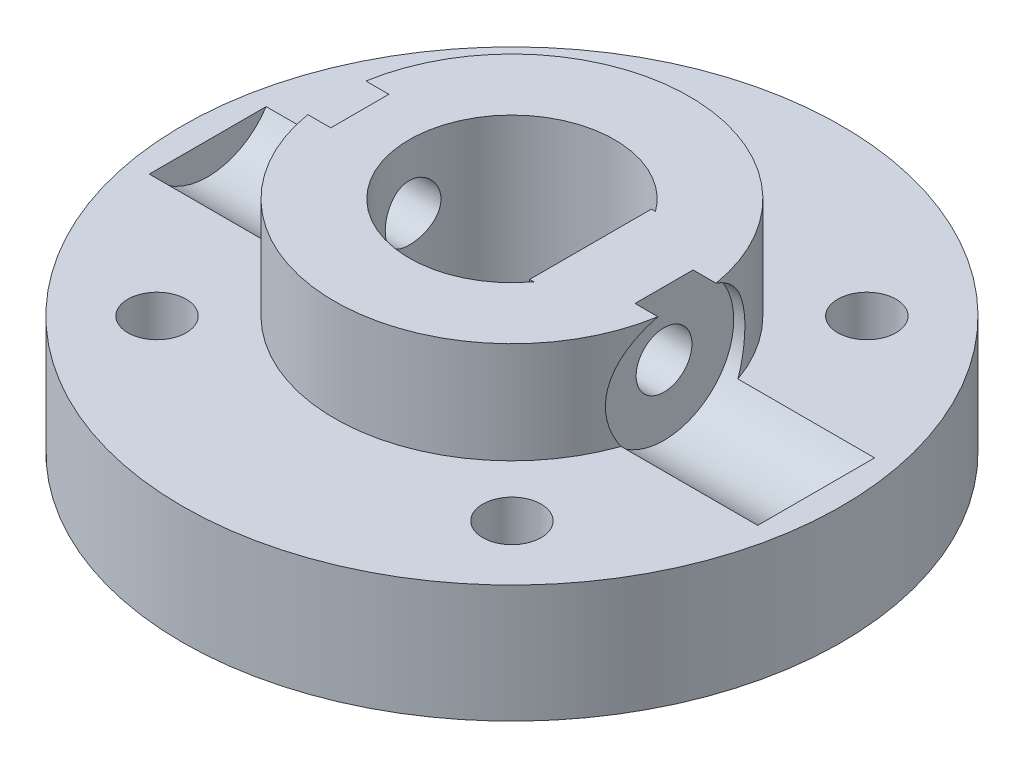
from build123d import *

# Parameters (mm, degrees)
STOCK_HORN_DRIVE_FLANGE_START              = 41
STOCK_HORN_DRIVE_FLANGE_PROFILE_R          = 13
STOCK_HORN_DRIVE_FLANGE_PROFILE_R_2        = 4.05
STOCK_HORN_DRIVE_FLANGE_DEPTH              = 3
D_COUPLING_RING_START                      = 44
D_COUPLING_RING_PROFILE_R                  = 7
D_COUPLING_RING_PROFILE_R_2                = 4.05
D_COUPLING_RING_DEPTH                      = 4
D_KEY_LAND_START                           = 44
D_KEY_LAND_PROFILE_W                       = 2.9
D_KEY_LAND_PROFILE_H                       = 4.8
D_KEY_LAND_DEPTH                           = 4
CAPTURED_HORN_KEY_BOSS_START               = 39.35
CAPTURED_HORN_KEY_BOSS_PROFILE_R           = 13
CAPTURED_HORN_KEY_BOSS_DEPTH               = 1.65
KEY_POCKET_HUB_START                       = 39.35
STOCK_HORN_POCKET_HUB_R                    = 3.55
KEY_POCKET_HUB_DEPTH                       = 1.65
KEY_POCKET_HORIZONTAL_START                = 39.35
STOCK_HORN_POCKET_HORIZONTAL_W             = 16.3
STOCK_HORN_POCKET_HORIZONTAL_H             = 4.2
KEY_POCKET_HORIZONTAL_DEPTH                = 1.65
KEY_POCKET_VERTICAL_START                  = 39.35
STOCK_HORN_POCKET_VERTICAL_W               = 4.2
STOCK_HORN_POCKET_VERTICAL_H               = 16.3
KEY_POCKET_VERTICAL_DEPTH                  = 1.65
KEY_POCKET_ROUNDED_TIPS_START              = 39.35
STOCK_HORN_POCKET_ROUNDED_TIPS_R           = 2.1
KEY_POCKET_ROUNDED_TIPS_DEPTH              = 1.65
UNMODIFIED_HORN_CAPTURE_M2_START           = -50
UNMODIFIED_HORN_CAPTURE_M2_PROFILE_R       = 1.15
UNMODIFIED_HORN_CAPTURE_M2_DEPTH           = 102.400389104
HUB_CLEARANCE_IN_KEY_BOSS_ONLY_START       = 39.35
HORN_CENTER_HUB_CLEARANCE_R                = 4
HUB_CLEARANCE_IN_KEY_BOSS_ONLY_DEPTH       = 1.65
YAW_POSITIVE_RETENTION_CROSSBOLT_START     = -10
YAW_POSITIVE_RETENTION_CROSSBOLT_PROFILE_R = 1.1
YAW_POSITIVE_RETENTION_CROSSBOLT_DEPTH     = 62.400389104
CROSSBOLT_FLAT_SEAT_CUT_12_START           = -12
CROSSBOLT_FLAT_SEAT_12_R                   = 2.75
CROSSBOLT_FLAT_SEAT_CUT_12_DEPTH           = 6
CROSSBOLT_FLAT_SEAT_CUT_6_START            = 6
CROSSBOLT_FLAT_SEAT_6_R                    = 2.75
CROSSBOLT_FLAT_SEAT_CUT_6_DEPTH            = 6


with BuildPart() as part:
    # Stock_horn_drive_flange_profile → Stock_horn_drive_flange (new body)
    with BuildSketch(Plane(origin=(0, 0, 0), x_dir=(1, 0, 0), z_dir=(0, 1, 0)).offset(STOCK_HORN_DRIVE_FLANGE_START)):
        Circle(STOCK_HORN_DRIVE_FLANGE_PROFILE_R)
        Circle(STOCK_HORN_DRIVE_FLANGE_PROFILE_R_2, mode=Mode.SUBTRACT)
    extrude(amount=STOCK_HORN_DRIVE_FLANGE_DEPTH)

    # D_coupling_ring_profile → D_coupling_ring (add)
    with BuildSketch(Plane(origin=(0, 0, 0), x_dir=(1, 0, 0), z_dir=(0, 1, 0)).offset(D_COUPLING_RING_START)):
        Circle(D_COUPLING_RING_PROFILE_R)
        Circle(D_COUPLING_RING_PROFILE_R_2, mode=Mode.SUBTRACT)
    extrude(amount=D_COUPLING_RING_DEPTH)

    # D_key_land_profile → D_key_land (add)
    with BuildSketch(Plane(origin=(0, 0, 0), x_dir=(1, 0, 0), z_dir=(0, 1, 0)).offset(D_KEY_LAND_START)):
        with Locations((4.55, 0)):
            Rectangle(D_KEY_LAND_PROFILE_W, D_KEY_LAND_PROFILE_H)
    extrude(amount=D_KEY_LAND_DEPTH)

    # Captured_horn_key_boss_profile → Captured_horn_key_boss (add)
    with BuildSketch(Plane(origin=(0, 0, 0), x_dir=(1, 0, 0), z_dir=(0, 1, 0)).offset(CAPTURED_HORN_KEY_BOSS_START)):
        Circle(CAPTURED_HORN_KEY_BOSS_PROFILE_R)
    extrude(amount=CAPTURED_HORN_KEY_BOSS_DEPTH)

    # Stock_horn_pocket_Hub → Key_pocket_Hub (cut)
    with BuildSketch(Plane(origin=(0, 0, 0), x_dir=(1, 0, 0), z_dir=(0, 1, 0)).offset(KEY_POCKET_HUB_START)):
        Circle(STOCK_HORN_POCKET_HUB_R)
    extrude(amount=KEY_POCKET_HUB_DEPTH, mode=Mode.SUBTRACT)

    # Stock_horn_pocket_Horizontal → Key_pocket_Horizontal (cut)
    with BuildSketch(Plane(origin=(0, 0, 0), x_dir=(1, 0, 0), z_dir=(0, 1, 0)).offset(KEY_POCKET_HORIZONTAL_START)):
        Rectangle(STOCK_HORN_POCKET_HORIZONTAL_W, STOCK_HORN_POCKET_HORIZONTAL_H)
    extrude(amount=KEY_POCKET_HORIZONTAL_DEPTH, mode=Mode.SUBTRACT)

    # Stock_horn_pocket_Vertical → Key_pocket_Vertical (cut)
    with BuildSketch(Plane(origin=(0, 0, 0), x_dir=(1, 0, 0), z_dir=(0, 1, 0)).offset(KEY_POCKET_VERTICAL_START)):
        Rectangle(STOCK_HORN_POCKET_VERTICAL_W, STOCK_HORN_POCKET_VERTICAL_H)
    extrude(amount=KEY_POCKET_VERTICAL_DEPTH, mode=Mode.SUBTRACT)

    # Stock_horn_pocket_Rounded_tips → Key_pocket_Rounded_tips (cut)
    with BuildSketch(Plane(origin=(0, 0, 0), x_dir=(1, 0, 0), z_dir=(0, 1, 0)).offset(KEY_POCKET_ROUNDED_TIPS_START)):
        with Locations((8.15, 0)):
            Circle(STOCK_HORN_POCKET_ROUNDED_TIPS_R)
        with Locations((-8.15, 0)):
            Circle(STOCK_HORN_POCKET_ROUNDED_TIPS_R)
        with Locations((0, 8.15)):
            Circle(STOCK_HORN_POCKET_ROUNDED_TIPS_R)
        with Locations((0, -8.15)):
            Circle(STOCK_HORN_POCKET_ROUNDED_TIPS_R)
    extrude(amount=KEY_POCKET_ROUNDED_TIPS_DEPTH, mode=Mode.SUBTRACT)

    # Unmodified_horn_capture_M2_profile → Unmodified_horn_capture_M2 (cut, through all)
    with BuildSketch(Plane(origin=(0, 0, 0), x_dir=(1, 0, 0), z_dir=(0, 1, 0)).offset(UNMODIFIED_HORN_CAPTURE_M2_START)):
        with Locations((7, 7)):
            Circle(UNMODIFIED_HORN_CAPTURE_M2_PROFILE_R)
        with Locations((-7, 7)):
            Circle(UNMODIFIED_HORN_CAPTURE_M2_PROFILE_R)
        with Locations((-7, -7)):
            Circle(UNMODIFIED_HORN_CAPTURE_M2_PROFILE_R)
        with Locations((7, -7)):
            Circle(UNMODIFIED_HORN_CAPTURE_M2_PROFILE_R)
    extrude(amount=UNMODIFIED_HORN_CAPTURE_M2_DEPTH, mode=Mode.SUBTRACT)

    # Horn_center_hub_clearance → Hub_clearance_in_key_boss_only (cut)
    with BuildSketch(Plane(origin=(0, 0, 0), x_dir=(1, 0, 0), z_dir=(0, 1, 0)).offset(HUB_CLEARANCE_IN_KEY_BOSS_ONLY_START)):
        Circle(HORN_CENTER_HUB_CLEARANCE_R)
    extrude(amount=HUB_CLEARANCE_IN_KEY_BOSS_ONLY_DEPTH, mode=Mode.SUBTRACT)

    # Yaw_positive_retention_crossbolt_profile → Yaw_positive_retention_crossbolt (cut, through all)
    with BuildSketch(Plane(origin=(0, 0, 0), x_dir=(0, 0, -1), z_dir=(1, 0, 0)).offset(YAW_POSITIVE_RETENTION_CROSSBOLT_START)):
        with Locations((0, 45.5)):
            Circle(YAW_POSITIVE_RETENTION_CROSSBOLT_PROFILE_R)
    extrude(amount=YAW_POSITIVE_RETENTION_CROSSBOLT_DEPTH, mode=Mode.SUBTRACT)

    # Crossbolt_flat_seat_-12 → Crossbolt_flat_seat_cut_-12 (cut)
    with BuildSketch(Plane(origin=(0, 0, 0), x_dir=(0, 0, -1), z_dir=(1, 0, 0)).offset(CROSSBOLT_FLAT_SEAT_CUT_12_START)):
        with Locations((0, 45.5)):
            Circle(CROSSBOLT_FLAT_SEAT_12_R)
    extrude(amount=CROSSBOLT_FLAT_SEAT_CUT_12_DEPTH, mode=Mode.SUBTRACT)

    # Crossbolt_flat_seat_6 → Crossbolt_flat_seat_cut_6 (cut)
    with BuildSketch(Plane(origin=(0, 0, 0), x_dir=(0, 0, -1), z_dir=(1, 0, 0)).offset(CROSSBOLT_FLAT_SEAT_CUT_6_START)):
        with Locations((0, 45.5)):
            Circle(CROSSBOLT_FLAT_SEAT_6_R)
    extrude(amount=CROSSBOLT_FLAT_SEAT_CUT_6_DEPTH, mode=Mode.SUBTRACT)


solid = part.part
